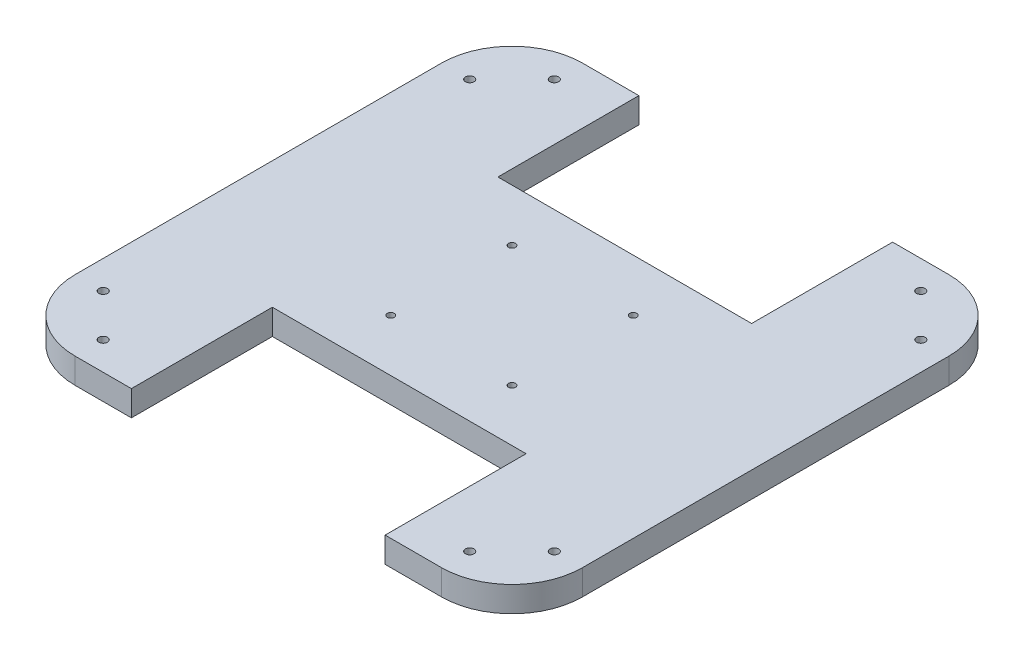
from build123d import *

# Parameters (mm, degrees)
PLATE_DEPTH        = 9
SKETCH3_R          = 1.525
HEX_HOLES_DEPTH    = 128.597021909
SKETCH4_R          = 1.25
LIDAR_HOLES_DEPTH  = 128.597021909
SKETCH5_W          = 90
SKETCH5_H          = 50
CUT_EXTRUDE1_DEPTH = 128.597021909


with BuildPart() as part:
    # Sketch1 → Plate (new body)
    with BuildSketch(Plane(origin=(0, 0, 0), x_dir=(1, 0, 0), z_dir=(0, 1, 0))):
        with BuildLine():
            Line((-65, -90), (65, -90))
            ThreePointArc((65, -90), (82.67766953, -82.67766953), (90, -65))
            Line((90, -65), (90, 65))
            ThreePointArc((90, 65), (82.67766953, 82.67766953), (65, 90))
            Line((65, 90), (-65, 90))
            ThreePointArc((-65, 90), (-82.67766953, 82.67766953), (-90, 65))
            Line((-90, 65), (-90, -65))
            ThreePointArc((-90, -65), (-82.67766953, -82.67766953), (-65, -90))
        make_face()
    extrude(amount=PLATE_DEPTH)

    # Sketch3 → Hex Holes (cut, through all)
    with BuildSketch(Plane(origin=(0, 9, 0), x_dir=(1, 0, 0), z_dir=(0, 1, 0))):
        with Locations((-65, 80)):
            Circle(SKETCH3_R)
        with Locations((-80, 65)):
            Circle(SKETCH3_R)
        with Locations((80, 65)):
            Circle(SKETCH3_R)
        with Locations((80, -65)):
            Circle(SKETCH3_R)
        with Locations((65, 80)):
            Circle(SKETCH3_R)
        with Locations((65, -80)):
            Circle(SKETCH3_R)
        with Locations((-65, -80)):
            Circle(SKETCH3_R)
        with Locations((-80, -65)):
            Circle(SKETCH3_R)
    extrude(amount=-HEX_HOLES_DEPTH, mode=Mode.SUBTRACT)

    # Sketch4 → LiDAR Holes (cut, through all)
    with BuildSketch(Plane(origin=(0, 9, 0), x_dir=(1, 0, 0), z_dir=(0, 1, 0))):
        with Locations((-21.5, 21.5)):
            Circle(SKETCH4_R)
        with Locations((21.5, 21.5)):
            Circle(SKETCH4_R)
        with Locations((21.5, -21.5)):
            Circle(SKETCH4_R)
        with Locations((-21.5, -21.5)):
            Circle(SKETCH4_R)
    extrude(amount=-LIDAR_HOLES_DEPTH, mode=Mode.SUBTRACT)

    # Sketch5 → Cut-Extrude1 (cut, through all)
    with BuildSketch(Plane(origin=(0, 9, 0), x_dir=(1, 0, 0), z_dir=(0, 1, 0))):
        with Locations((0, 65)):
            Rectangle(SKETCH5_W, SKETCH5_H)
        with Locations((0, -65)):
            Rectangle(SKETCH5_W, SKETCH5_H)
    extrude(amount=-CUT_EXTRUDE1_DEPTH, mode=Mode.SUBTRACT)


solid = part.part
